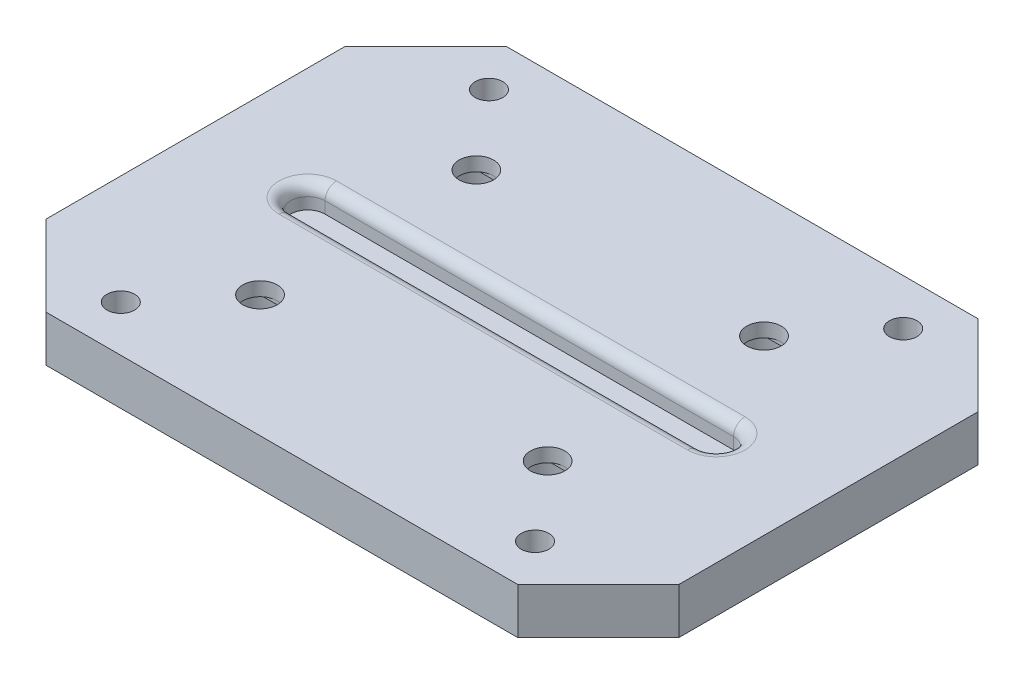
from build123d import *

# Parameters (mm, degrees)
SKETCH2_W           = 55
SKETCH2_H           = 40
SKETCH2_R           = 1.2
BOSS_EXTRUDE1_DEPTH = 4
CHAMFER1_SIZE       = 7
SKETCH3_R           = 1.5
CUT_EXTRUDE1_DEPTH  = 35.062442661
FILLET1_R           = 1
CUT_EXTRUDE2_START  = 0.5
SKETCH4_R           = 2.5
CUT_EXTRUDE2_DEPTH  = 35.562442661
CUT_EXTRUDE6_START  = 0.3
CUT_EXTRUDE6_DEPTH  = 0.3


with BuildPart() as part:
    # Sketch2 → Boss-Extrude1 (new body)
    with BuildSketch(Plane(origin=(0, 0, 0), x_dir=(1, 0, 0), z_dir=(0, 1, 0))):
        Rectangle(SKETCH2_W, SKETCH2_H)
        with Locations((-18, -16)):
            Circle(SKETCH2_R, mode=Mode.SUBTRACT)
        with Locations((18, -16)):
            Circle(SKETCH2_R, mode=Mode.SUBTRACT)
        with Locations((-18, 16)):
            Circle(SKETCH2_R, mode=Mode.SUBTRACT)
        with Locations((18, 16)):
            Circle(SKETCH2_R, mode=Mode.SUBTRACT)
    extrude(amount=-BOSS_EXTRUDE1_DEPTH)

    # Chamfer1
    chamfer1_edges = [part.edges().sort_by_distance(p)[0] for p in [
        (-27.5, -2, 20),
        (27.5, -2, 20),
        (27.5, -2, -20),
        (-27.5, -2, -20),
    ]]
    chamfer(chamfer1_edges, length=CHAMFER1_SIZE)

    # Sketch3 → Cut-Extrude1 (cut, through all)
    with BuildSketch(Plane(origin=(0, -2, 0), x_dir=(1, 0, 0), z_dir=(0, 1, 0))):
        with Locations((12.5, 9.4)):
            Circle(SKETCH3_R)
        with Locations((-12.5, 9.4)):
            Circle(SKETCH3_R)
        with Locations((-12.5, -9.4)):
            Circle(SKETCH3_R)
        with Locations((12.5, -9.4)):
            Circle(SKETCH3_R)
        with BuildLine():
            Line((17.75, 1.5), (-17.75, 1.5))
            ThreePointArc((-17.75, 1.5), (-19.25, 0), (-17.75, -1.5))
            Line((-17.75, -1.5), (17.75, -1.5))
            ThreePointArc((17.75, -1.5), (19.25, 0), (17.75, 1.5))
        make_face()
    extrude(amount=CUT_EXTRUDE1_DEPTH, mode=Mode.SUBTRACT)

    # Fillet1
    fillet1_edges = [part.edges().sort_by_distance(p)[0] for p in [
        (19.25, 0, 0),
        (0, 0, 1.5),
        (-19.25, 0, 0),
        (0, 0, -1.5),
    ]]
    fillet(fillet1_edges, radius=FILLET1_R)

    # Sketch4 → Cut-Extrude2 (cut, through all)
    with BuildSketch(Plane(origin=(0, -2, 0), x_dir=(1, 0, 0), z_dir=(0, 1, 0)).offset(CUT_EXTRUDE2_START)):
        with Locations((-12.5, 9.4)):
            Circle(SKETCH4_R)
        with Locations((12.5, 9.4)):
            Circle(SKETCH4_R)
        with Locations((-12.5, -9.4)):
            Circle(SKETCH4_R)
        with Locations((12.5, -9.4)):
            Circle(SKETCH4_R)
    extrude(amount=-CUT_EXTRUDE2_DEPTH, mode=Mode.SUBTRACT)

    # Sketch5 → Cut-Extrude6 (cut)
    with BuildSketch(Plane(origin=(0, -1.5, 0), x_dir=(1, 0, 0), z_dir=(0, 1, 0)).offset(CUT_EXTRUDE6_START)):
        with BuildLine():
            Line((-14.5, -10.9), (-10.5, -10.9))
            ThreePointArc((-10.5, -10.9), (-10, -9.4), (-10.5, -7.9))
            Line((-10.5, -7.9), (-14.5, -7.9))
            ThreePointArc((-14.5, -7.9), (-15, -9.4), (-14.5, -10.9))
        make_face()
        with BuildLine():
            Line((-14.5, 7.9), (-10.5, 7.9))
            ThreePointArc((-10.5, 7.9), (-10, 9.4), (-10.5, 10.9))
            Line((-10.5, 10.9), (-14.5, 10.9))
            ThreePointArc((-14.5, 10.9), (-15, 9.4), (-14.5, 7.9))
        make_face()
        with BuildLine():
            Line((10.5, -10.9), (14.5, -10.9))
            ThreePointArc((14.5, -10.9), (15, -9.4), (14.5, -7.9))
            Line((14.5, -7.9), (10.5, -7.9))
            ThreePointArc((10.5, -7.9), (10, -9.4), (10.5, -10.9))
        make_face()
        with BuildLine():
            Line((10.5, 7.9), (14.5, 7.9))
            ThreePointArc((14.5, 7.9), (15, 9.4), (14.5, 10.9))
            Line((14.5, 10.9), (10.5, 10.9))
            ThreePointArc((10.5, 10.9), (10, 9.4), (10.5, 7.9))
        make_face()
    extrude(amount=-CUT_EXTRUDE6_DEPTH, mode=Mode.SUBTRACT)


solid = part.part
